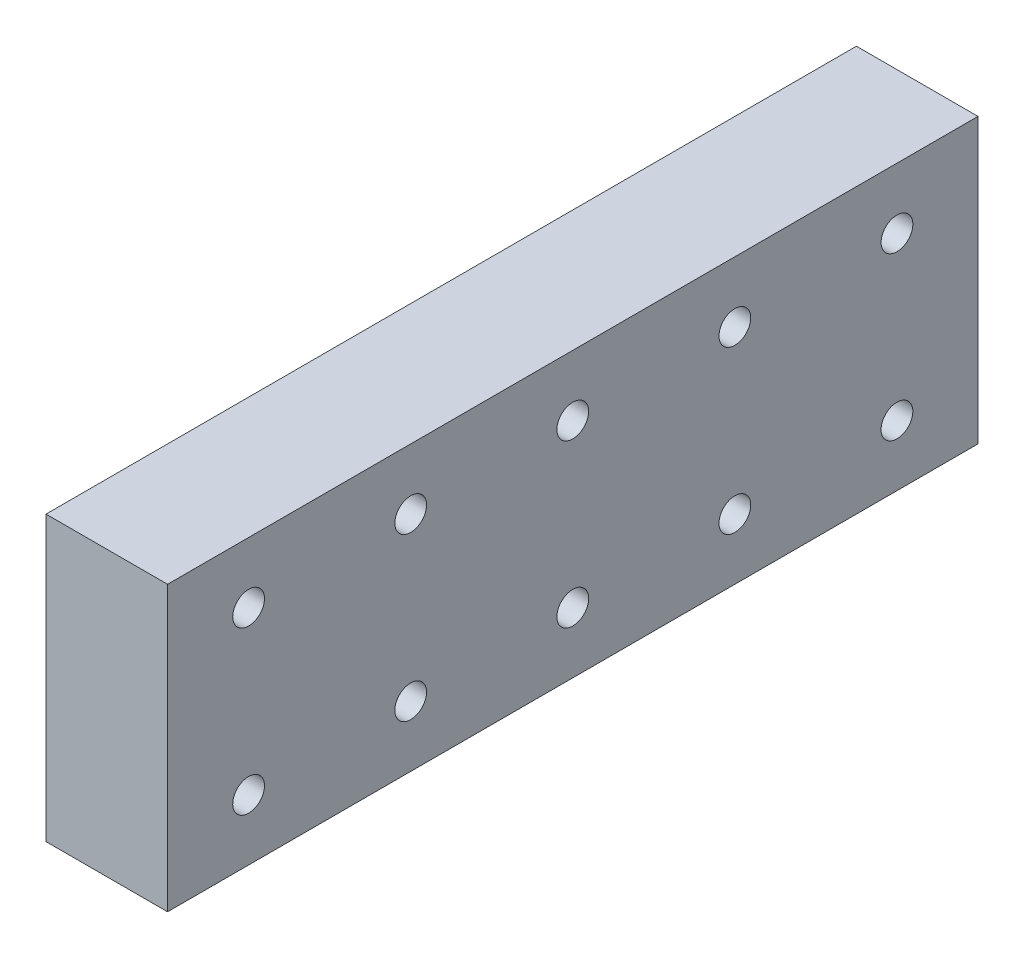
from build123d import *

# Parameters (mm, degrees)
SKETCH1_W           = 19.05
SKETCH1_H           = 44.45
BOSS_EXTRUDE1_DEPTH = 127
SKETCH2_R           = 2.4892
CUT_EXTRUDE1_DEPTH  = 136.89593445


with BuildPart() as part:
    # Sketch1 → Boss-Extrude1 (new body)
    with BuildSketch(Plane.XY):
        with Locations((9.525, 22.225)):
            Rectangle(SKETCH1_W, SKETCH1_H)
    extrude(amount=BOSS_EXTRUDE1_DEPTH)

    # Sketch2 → Cut-Extrude1 (cut, through all)
    with BuildSketch(Plane(origin=(19.05, 0, 0), x_dir=(0, 0, -1), z_dir=(1, 0, 0))):
        with Locations((-114.3, 9.525)):
            Circle(SKETCH2_R)
        with Locations((-88.9, 9.525)):
            Circle(SKETCH2_R)
        with Locations((-63.5, 9.525)):
            Circle(SKETCH2_R)
        with Locations((-114.3, 34.925)):
            Circle(SKETCH2_R)
        with Locations((-88.9, 34.925)):
            Circle(SKETCH2_R)
        with Locations((-63.5, 34.925)):
            Circle(SKETCH2_R)
        with Locations((-38.1, 9.525)):
            Circle(SKETCH2_R)
        with Locations((-12.7, 9.525)):
            Circle(SKETCH2_R)
        with Locations((-38.1, 34.925)):
            Circle(SKETCH2_R)
        with Locations((-12.7, 34.925)):
            Circle(SKETCH2_R)
    extrude(amount=-CUT_EXTRUDE1_DEPTH, mode=Mode.SUBTRACT)


solid = part.part
